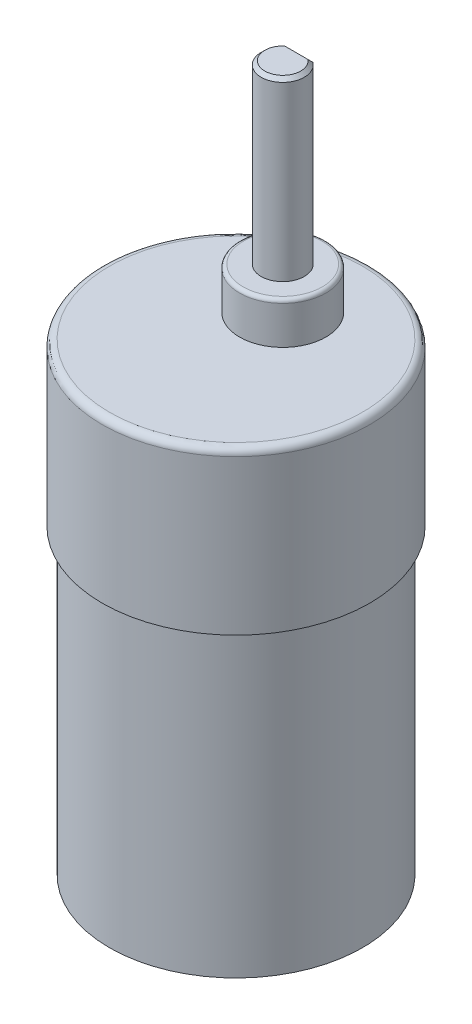
from build123d import *

# Parameters (mm, degrees)
SKETCH1_R           = 18.6
BOSS_EXTRUDE1_DEPTH = 22.5
SKETCH2_R           = 6
BOSS_EXTRUDE2_DEPTH = 5.8
BOSS_EXTRUDE3_DEPTH = 24.5
SKETCH4_R           = 17.6
BOSS_EXTRUDE4_DEPTH = 42
SKETCH5_R           = 17
CUT_EXTRUDE1_DEPTH  = 1
SKETCH6_R           = 4.9
BOSS_EXTRUDE5_DEPTH = 3.7
BOSS_EXTRUDE7_DEPTH = 5
SKETCH9_R           = 0.5
CUT_EXTRUDE3_DEPTH  = 62.010578213
SKETCH10_R          = 0.5
CUT_EXTRUDE4_DEPTH  = 62.324880349
CHAMFER2_SIZE       = 0.5
CHAMFER3_SIZE       = 0.5
FILLET2_R           = 1
FILLET3_R           = 0.5
CHAMFER4_SIZE       = 0.5
FILLET4_R           = 2


with BuildPart() as part:
    # Sketch1 → Boss-Extrude1 (new body)
    with BuildSketch(Plane(origin=(0, 0, 0), x_dir=(1, 0, 0), z_dir=(0, 1, 0))):
        Circle(SKETCH1_R)
    extrude(amount=BOSS_EXTRUDE1_DEPTH)

    # Sketch2 → Boss-Extrude2 (add)
    with BuildSketch(Plane(origin=(0, 22.5, 0), x_dir=(1, 0, 0), z_dir=(0, 1, 0))):
        with Locations((0, 6.5)):
            Circle(SKETCH2_R)
    extrude(amount=BOSS_EXTRUDE2_DEPTH)

    # Sketch4 → Boss-Extrude4 (add)
    with BuildSketch(Plane.XZ):
        Circle(SKETCH4_R)
    extrude(amount=BOSS_EXTRUDE4_DEPTH)

    # Sketch5 → Cut-Extrude1 (cut)
    with BuildSketch(Plane.XZ.offset(42)):
        Circle(SKETCH5_R)
    extrude(amount=-CUT_EXTRUDE1_DEPTH, mode=Mode.SUBTRACT)

    # Sketch6 → Boss-Extrude5 (add)
    with BuildSketch(Plane.XZ.offset(41)):
        Circle(SKETCH6_R)
    extrude(amount=BOSS_EXTRUDE5_DEPTH)

    # Sketch8 → Boss-Extrude7 (add)
    with BuildSketch(Plane.XZ.offset(41)):
        Polygon((7.943642648, -7.005312351), (8.409423923, -6.823521801), (9.500167221, -9.61820945), (9.034385946, -9.8), align=None)
        Polygon((-8.409423923, -6.823521801), (-7.943642648, -7.005312351), (-9.034385946, -9.8), (-9.500167221, -9.61820945), align=None)
    extrude(amount=BOSS_EXTRUDE7_DEPTH)

    # Sketch9 → Cut-Extrude3 (cut, through all)
    with BuildSketch(Plane(origin=(-5.359437966, 0, -0.384098246), x_dir=(-0.3635810993451648, 0, -0.9315625498048757), z_dir=(0.9315625498048757, 0, -0.36358109934516486))):
        with Locations((8.607643073, -45)):
            Circle(SKETCH9_R)
    extrude(amount=-CUT_EXTRUDE3_DEPTH, mode=Mode.SUBTRACT)

    # Sketch10 → Cut-Extrude4 (cut, through all)
    with BuildSketch(Plane(origin=(4.133997261, 0, 2.755709267), x_dir=(0.36358109934513905, 0, -0.9315625498048857), z_dir=(0.9315625498048857, 0, 0.36358109934513905))):
        with Locations((11.978117245, -45)):
            Circle(SKETCH10_R)
    extrude(amount=CUT_EXTRUDE4_DEPTH, mode=Mode.SUBTRACT)

    # Chamfer2
    chamfer2_edges = [part.edges().sort_by_distance(p)[0] for p in [
        (8.176533286, -46, -6.914417076),
        (9.267276584, -46, -9.709104725),
    ]]
    chamfer(chamfer2_edges, length=CHAMFER2_SIZE)

    # Chamfer3
    chamfer3_edges = [part.edges().sort_by_distance(p)[0] for p in [
        (-8.176533286, -46, -6.914417076),
        (-9.267276584, -46, -9.709104725),
    ]]
    chamfer(chamfer3_edges, length=CHAMFER3_SIZE)

    # Fillet2
    fillet2_edges = [part.edges().sort_by_distance(p)[0] for p in [
        (-18.6, 22.5, 0),
    ]]
    fillet(fillet2_edges, radius=FILLET2_R)

    # Fillet3
    fillet3_edges = [part.edges().sort_by_distance(p)[0] for p in [
        (-6, 28.3, -6.5),
    ]]
    fillet(fillet3_edges, radius=FILLET3_R)

    # Fillet4
    fillet4_edges = [part.edges().sort_by_distance(p)[0] for p in [
        (-4.9, -44.7, 0),
    ]]
    fillet(fillet4_edges, radius=FILLET4_R)


with BuildPart() as body_2:
    # Sketch3 → Boss-Extrude3 (new body)
    with BuildSketch(Plane(origin=(0, 28.3, 0), x_dir=(1, 0, 0), z_dir=(0, 1, 0))):
        with BuildLine():
            Line((-1.8, 8.9), (1.8, 8.9))
            ThreePointArc((1.8, 8.9), (0, 3.5), (-1.8, 8.9))
        make_face()
    extrude(amount=BOSS_EXTRUDE3_DEPTH)

    # Chamfer4
    chamfer4_edges = [body_2.edges().sort_by_distance(p)[0] for p in [
        (0, 52.8, -8.9),
        (0, 52.8, -3.5),
    ]]
    chamfer(chamfer4_edges, length=CHAMFER4_SIZE)


solid = Compound([part.part, body_2.part])
